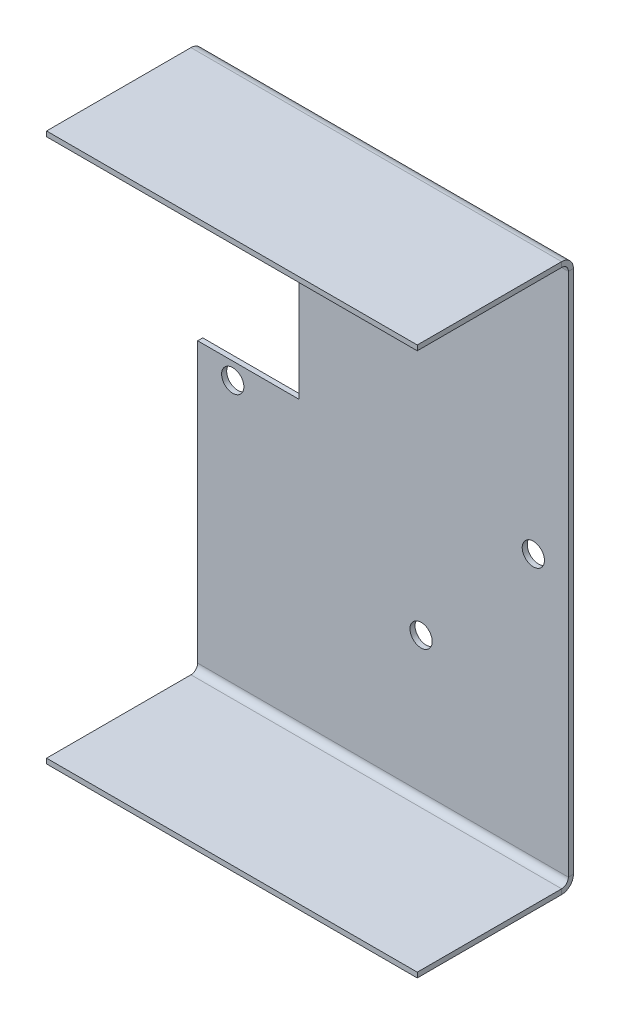
from build123d import *

# Parameters (mm, degrees)
ESBO_O1_W                   = 110
ESBO_O1_H                   = 250
RESSALTO_EXTRUS_O1_DEPTH    = 1.5
FURO_COM_FOLGA_DE_M62_D     = 6.6
FURO_COM_FOLGA_DE_M62_DEPTH = 10
FURO_COM_FOLGA_DE_M62_TIP   = 1.982840043
DOBRA_START                 = -55
DOBRA_ESBO_ADA1_DEPTH       = 110
DOBRA_ESBO_ADA1_2_DEPTH     = 110
DOBRA_ESBO_ADA2_DEPTH       = 110
DOBRA_ESBO_ADA2_2_DEPTH     = 110
ESBO_O12_W                  = 30
ESBO_O12_H                  = 63
CORTE_EXTRUS_O1_DEPTH       = 10


# Read off the part's stored shape, not the designer's step: Dobra esboçada1, Dobra esboçada2
with BuildPart() as part:
    # Esboço1 → Ressalto-extrusão1 (new body)
    with BuildSketch(Plane.XY):
        Rectangle(ESBO_O1_W, ESBO_O1_H)
    extrude(amount=RESSALTO_EXTRUS_O1_DEPTH)

    # Furo com folga de M62
    with Locations(Plane.XY.offset(1.5)):
        with Locations((0, 51), (-44.6, 0), (44.6, 0), (11.3, -37.5)):
            Hole(FURO_COM_FOLGA_DE_M62_D / 2, depth=FURO_COM_FOLGA_DE_M62_DEPTH)
            with Locations((0, 0, -(FURO_COM_FOLGA_DE_M62_DEPTH + FURO_COM_FOLGA_DE_M62_TIP / 2))):  # 118° drill point
                Cone(0, FURO_COM_FOLGA_DE_M62_D / 2, FURO_COM_FOLGA_DE_M62_TIP, mode=Mode.SUBTRACT)

    # Dobra esboçada1 outline → Dobra esboçada1 (cut)
    with BuildSketch(Plane.YZ.offset(DOBRA_START)):
        with BuildLine():
            ThreePointArc((-77.840155051, 0), (-79.460340225, 0.397581589), (-80.712436374, 1.5))
            Line((-80.712436374, 1.5), (-125, 1.5))
            Line((-125, 1.5), (-125, 0))
            Line((-125, 0), (-77.840155051, 0))
        make_face()
    extrude(amount=DOBRA_ESBO_ADA1_DEPTH, mode=Mode.SUBTRACT)

    # Dobra esbo_ada1 2 outline → Dobra esbo_ada1 2 (add)
    with BuildSketch(Plane.YZ.offset(DOBRA_START)):
        with BuildLine():
            ThreePointArc((-77.840155051, 1.5), (-79.254368613, 2.085786438), (-79.840155051, 3.5))
            Line((-79.840155051, 3.5), (-79.840155051, 46.340155051))
            Line((-79.840155051, 46.340155051), (-81.340155051, 46.340155051))
            Line((-81.340155051, 46.340155051), (-81.340155051, 3.5))
            ThreePointArc((-81.340155051, 3.5), (-81.179540071, 2.451902827), (-80.712436374, 1.5))
            Line((-80.712436374, 1.5), (-77.840155051, 1.5))
        make_face()
    extrude(amount=DOBRA_ESBO_ADA1_2_DEPTH)

    # Dobra esboçada2 outline → Dobra esboçada2 (cut)
    with BuildSketch(Plane.YZ.offset(DOBRA_START)):
        with BuildLine():
            Line((125, 1.5), (80.712436374, 1.5))
            ThreePointArc((80.712436374, 1.5), (79.460340225, 0.397581589), (77.840155051, 0))
            Line((77.840155051, 0), (125, 0))
            Line((125, 0), (125, 1.5))
        make_face()
    extrude(amount=DOBRA_ESBO_ADA2_DEPTH, mode=Mode.SUBTRACT)

    # Dobra esbo_ada2 2 outline → Dobra esbo_ada2 2 (add)
    with BuildSketch(Plane.YZ.offset(DOBRA_START)):
        with BuildLine():
            Line((81.340155051, 3.5), (81.340155051, 46.340155051))
            Line((81.340155051, 46.340155051), (79.840155051, 46.340155051))
            Line((79.840155051, 46.340155051), (79.840155051, 3.5))
            ThreePointArc((79.840155051, 3.5), (79.254368613, 2.085786438), (77.840155051, 1.5))
            Line((77.840155051, 1.5), (80.712436374, 1.5))
            ThreePointArc((80.712436374, 1.5), (81.179540071, 2.451902827), (81.340155051, 3.5))
        make_face()
    extrude(amount=DOBRA_ESBO_ADA2_2_DEPTH)

    # Esboço12 → Corte-extrusão1 (cut)
    with BuildSketch(Plane(origin=(0, 0, 0), x_dir=(-1, 0, 0), z_dir=(0, 0, -1))):
        with Locations((40, 36.5)):
            Rectangle(ESBO_O12_W, ESBO_O12_H)
    extrude(amount=-CORTE_EXTRUS_O1_DEPTH, mode=Mode.SUBTRACT)


solid = part.part
